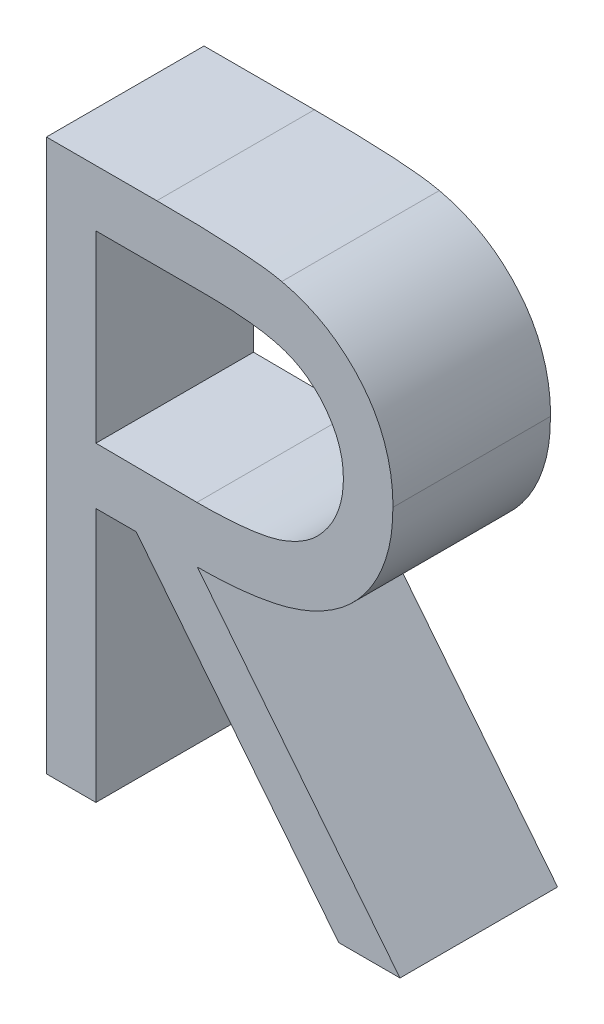
from build123d import *

# Parameters (mm, degrees)
BOSS_EXTRUDE1_DEPTH = 1


with BuildPart() as part:
    # Sketch1 → Boss-Extrude1 (new body)
    with BuildSketch(Plane.XY):
        with BuildLine():
            Line((0.448717949, 3.5), (1.149138622, 3.5))
            add(Edge.make_bspline(
                [(1.149138622, 3.5), (1.19587975, 3.499844414), (1.285627895, 3.499545672), (1.414201165, 3.497879909), (1.531028262, 3.493105553), (1.636048101, 3.48899697), (1.729258756, 3.481505028), (1.810946047, 3.474344381), (1.880733745, 3.46497072), (1.922979596, 3.456265297), (1.942107372, 3.452323718)],
                knots=[0, 0, 0, 0, 1.410062039, 2.707475311, 3.878576406, 4.937260626, 5.877586885, 6.699081471, 7.410979367, 8, 8, 8, 8], degree=3))
            add(Edge.make_bspline(
                [(1.942107372, 3.452323718), (1.967713996, 3.445996953), (2.018380985, 3.433478389), (2.091331051, 3.407018788), (2.160845375, 3.376399163), (2.2266352, 3.340435443), (2.288370991, 3.298860663), (2.346689302, 3.252392541), (2.401854765, 3.201285335), (2.451636395, 3.144250494), (2.498575447, 3.084413984), (2.538164073, 3.019710227), (2.572290553, 2.9520487), (2.59946107, 2.880741282), (2.621339044, 2.80647951), (2.636765283, 2.728590713), (2.646016471, 2.647429738), (2.646958326, 2.59207183), (2.647435897, 2.564002404)],
                knots=[0, 0, 0, 0, 1.027469482, 2.033020251, 3.019912614, 3.986113645, 4.951240523, 5.91722682, 6.890402269, 7.87763091, 8.8651537, 9.85103654, 10.82876324, 11.815024772, 12.821070561, 13.842952187, 14.906261191, 16, 16, 16, 16], degree=3))
            add(Edge.make_bspline(
                [(2.647435897, 2.564002404), (2.645966899, 2.517367299), (2.643100504, 2.426370131), (2.6163754, 2.29430925), (2.57259888, 2.171119935), (2.512275591, 2.056957297), (2.435456115, 1.954046652), (2.343131324, 1.863656197), (2.235249713, 1.788016284), (2.134820397, 1.735563479), (2.046106197, 1.701970571), (1.973072884, 1.678334212), (1.893405907, 1.660072247), (1.807868572, 1.643712115), (1.716104917, 1.63136042), (1.618334877, 1.622313826), (1.514488726, 1.616659777), (1.443149656, 1.615817772), (1.406450321, 1.615384615)],
                knots=[0, 0, 0, 0, 1.260483769, 2.459530307, 3.627416485, 4.787058657, 5.939039949, 7.08810263, 8.267026773, 9.491475466, 10.141966685, 10.831826277, 11.566392101, 12.351337768, 13.187381173, 14.07005841, 15.007169909, 16, 16, 16, 16], degree=3))
            Line((1.406450321, 1.615384615), (2.692307692, 0))
            Line((2.692307692, 0), (2.303886218, 0))
            Line((2.303886218, 0), (1.018028846, 1.615384615))
            Line((1.018028846, 1.615384615), (0.762820513, 1.615384615))
            Line((0.762820513, 1.615384615), (0.762820513, 0))
            Line((0.762820513, 0), (0.448717949, 0))
            Line((0.448717949, 0), (0.448717949, 3.5))
        make_face()
        with BuildLine():
            Line((0.762820513, 3.141025641), (0.762820513, 1.974358974))
            Line((0.762820513, 1.974358974), (1.403645833, 1.969451122))
            add(Edge.make_bspline(
                [(1.403645833, 1.969451122), (1.433565872, 1.969437885), (1.491559429, 1.969412229), (1.575460094, 1.973406005), (1.653580206, 1.977949323), (1.725620958, 1.984898669), (1.791614533, 1.99385474), (1.851527947, 2.005057725), (1.905458998, 2.018109787), (1.968357537, 2.038311413), (2.038594068, 2.070317431), (2.114925528, 2.11688293), (2.179927866, 2.175452049), (2.234845728, 2.242425505), (2.27897516, 2.316061754), (2.310087214, 2.395478123), (2.329829656, 2.478669721), (2.332158202, 2.535847829), (2.333333333, 2.564703526)],
                knots=[0, 0, 0, 0, 1.146690395, 2.22261258, 3.21895312, 4.145990853, 4.996080663, 5.770904154, 6.481378293, 7.121626537, 8.300444488, 9.431385265, 10.535395872, 11.636531494, 12.74115979, 13.810798291, 14.895190096, 16, 16, 16, 16], degree=3))
            add(Edge.make_bspline(
                [(2.333333333, 2.564703526), (2.332131212, 2.592850099), (2.329749047, 2.648626338), (2.310300278, 2.730282248), (2.277410897, 2.807349198), (2.233088659, 2.879513683), (2.179089504, 2.945019419), (2.115771691, 3.001066572), (2.044866496, 3.047316037), (1.978595298, 3.076870418), (1.919361085, 3.094990271), (1.867931425, 3.107741435), (1.809819948, 3.117985904), (1.744744489, 3.126193964), (1.672982858, 3.133248909), (1.594172207, 3.138000687), (1.508835427, 3.140814551), (1.449688496, 3.14095364), (1.419070513, 3.141025641)],
                knots=[0, 0, 0, 0, 1.101028733, 2.181837193, 3.264309656, 4.369019818, 5.486613113, 6.575447106, 7.666700264, 8.788928104, 9.402425223, 10.0903467, 10.862060571, 11.710948788, 12.657782767, 13.684531032, 14.801375019, 16, 16, 16, 16], degree=3))
            Line((1.419070513, 3.141025641), (0.762820513, 3.141025641))
        make_face(mode=Mode.SUBTRACT)
    extrude(amount=BOSS_EXTRUDE1_DEPTH)


solid = part.part
